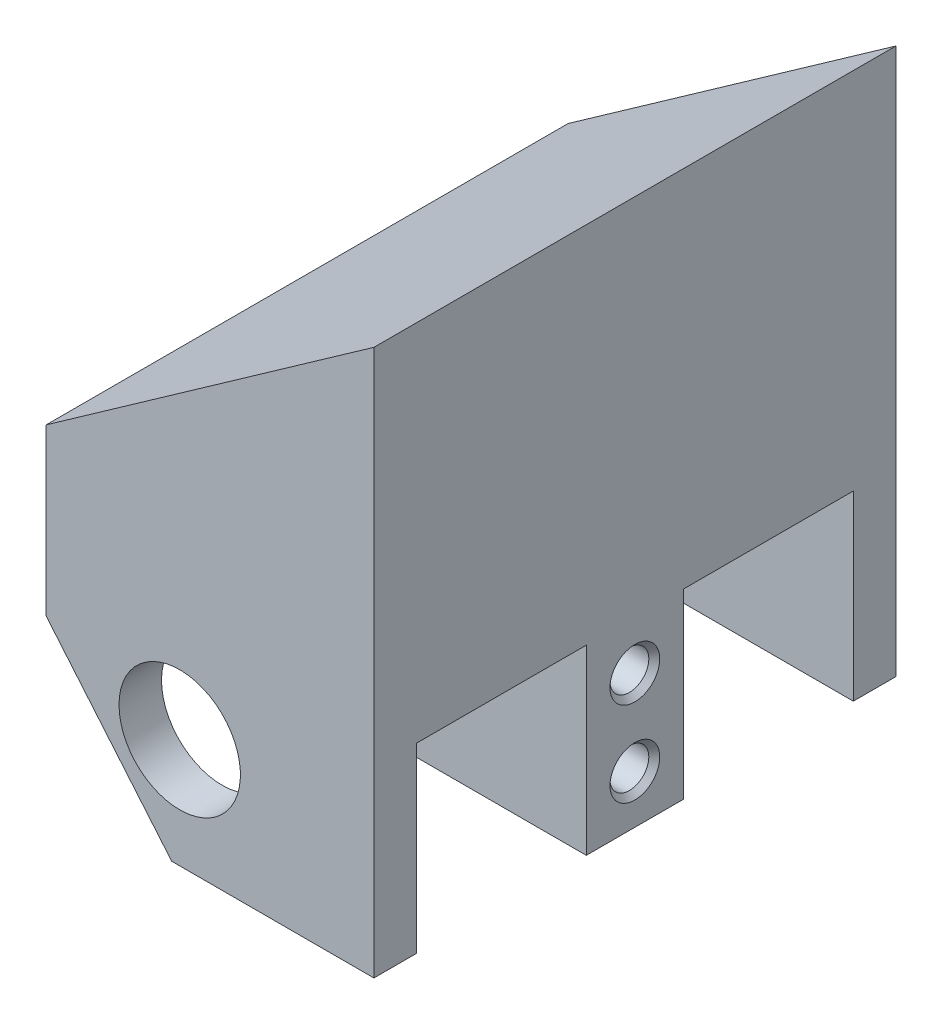
from build123d import *

# Parameters (mm, degrees)
BOSS_EXTRUDE1_DEPTH             = 21.5
SKETCH2_R                       = 2.5
CUT_EXTRUDE1_DEPTH              = 28.772402
SKETCH2_3_R                     = 2.5
CUT_EXTRUDE2_DEPTH              = 11
CUT_EXTRUDE3_DEPTH              = 28.772402
CUT_EXTRUDE4_DEPTH              = 27.410967055
SKETCH7_W                       = 7
SKETCH7_H                       = 7.5
CUT_EXTRUDE5_DEPTH              = 29.754869584
M2X0_4_TAPPED_HOLE1_D           = 1.6
M2X0_4_TAPPED_HOLE1_DEPTH       = 5
M2X0_4_TAPPED_HOLE1_CSINK_D     = 2.05
M2X0_4_TAPPED_HOLE1_CSINK_ANGLE = 90
M2X0_4_TAPPED_HOLE1_TIP         = 0.480688495


with BuildPart() as part:
    # Sketch1 → Boss-Extrude1 (new body)
    with BuildSketch(Plane.XY):
        Polygon((-7.276445285, -10.518598852), (2.223554715, -16.00342641), (6.223554715, -16.00342641), (6.223554715, 8.99657359), (-7.276445285, -0.518598852), align=None)
    extrude(amount=BOSS_EXTRUDE1_DEPTH)

    # Sketch2 → Cut-Extrude1 (cut, through all)
    with BuildSketch(Plane(origin=(0, 0, 0), x_dir=(-1, 0, 0), z_dir=(0, 0, -1))):
        with Locations((1.776445285, -9.00342641)):
            Circle(SKETCH2_R)
    extrude(amount=-CUT_EXTRUDE1_DEPTH, mode=Mode.SUBTRACT)

    # Sketch2<3> → Cut-Extrude2 (cut)
    with BuildSketch(Plane(origin=(0, 0, 0), x_dir=(-1, 0, 0), z_dir=(0, 0, -1))):
        with Locations((4.276445285, -3.00342641)):
            Circle(SKETCH2_3_R)
    extrude(amount=-CUT_EXTRUDE2_DEPTH, mode=Mode.SUBTRACT)

    # Sketch5 → Cut-Extrude3 (cut, through all)
    with BuildSketch(Plane(origin=(0, 0, 0), x_dir=(-1, 0, 0), z_dir=(0, 0, -1))):
        Polygon((-6.223554715, -13.50342641), (2.106572304, -13.50342641), (-2.223554715, -16.00342641), (-6.223554715, -16.00342641), align=None)
    extrude(amount=-CUT_EXTRUDE3_DEPTH, mode=Mode.SUBTRACT)

    # Sketch6 → Cut-Extrude4 (cut, through all)
    with BuildSketch(Plane(origin=(0, 0, 0), x_dir=(-1, 0, 0), z_dir=(0, 0, -1))):
        Polygon((2.106572304, -13.50342641), (7.276445285, -7.342211711), (7.276445285, -10.518598852), align=None)
    extrude(amount=-CUT_EXTRUDE4_DEPTH, mode=Mode.SUBTRACT)

    # Sketch7 → Cut-Extrude5 (cut, through all)
    with BuildSketch(Plane(origin=(6.223554715, 0, 0), x_dir=(0, 0, -1), z_dir=(1, 0, 0))):
        with Locations((-16.25, -9.75342641)):
            Rectangle(SKETCH7_W, SKETCH7_H)
        with Locations((-5.25, -9.75342641)):
            Rectangle(SKETCH7_W, SKETCH7_H)
    extrude(amount=-CUT_EXTRUDE5_DEPTH, mode=Mode.SUBTRACT)

    # M2x0.4 Tapped Hole1
    with Locations(Plane(origin=(6.223554715, 0, 0), x_dir=(0, 0, -1), z_dir=(1, 0, 0))):
        with Locations((-10.75, -8.00342641), (-10.75, -11.50342641)):
            CounterSinkHole(M2X0_4_TAPPED_HOLE1_D / 2, M2X0_4_TAPPED_HOLE1_CSINK_D / 2, depth=M2X0_4_TAPPED_HOLE1_DEPTH, counter_sink_angle=M2X0_4_TAPPED_HOLE1_CSINK_ANGLE)
            with Locations((0, 0, -(M2X0_4_TAPPED_HOLE1_DEPTH + M2X0_4_TAPPED_HOLE1_TIP / 2))):  # 118° drill point
                Cone(0, M2X0_4_TAPPED_HOLE1_D / 2, M2X0_4_TAPPED_HOLE1_TIP, mode=Mode.SUBTRACT)


solid = part.part
